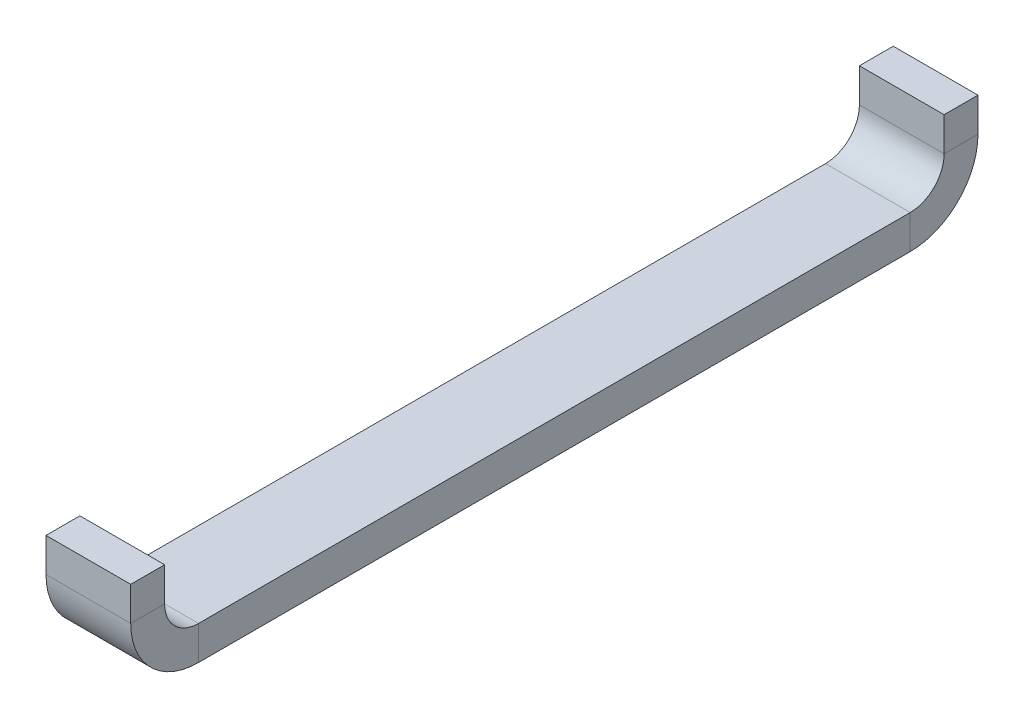
from build123d import *

# Parameters (mm, degrees)
ESQUISSE2_W                             = 5
ESQUISSE2_H                             = 50
T_LE_DE_BASE_PLI_E1_DEPTH               = 2
T_LE_PLI_E_SUR_AR_TE1_STRIP_W           = 12
T_LE_PLI_E_SUR_AR_TE1_STRIP_H           = 2
T_LE_PLI_E_SUR_AR_TE1_STRIP_CUT_DEPTH   = 5
T_LE_PLI_E_SUR_AR_TE1_STRIP_2_W         = 12
T_LE_PLI_E_SUR_AR_TE1_STRIP_2_H         = 2
T_LE_PLI_E_SUR_AR_TE1_STRIP_CUT_2_DEPTH = 5
T_LE_PLI_E_SUR_AR_TE1_DEPTH             = 5
T_LE_PLI_E_SUR_AR_TE1_BEND_DEPTH        = 5


# Sheet-metal steps are written as plain solids
with BuildPart() as part:
    # Esquisse2 → Tôle de base pliée1 (new body)
    with BuildSketch(Plane(origin=(0, 0, 0), x_dir=(1, 0, 0), z_dir=(0, 1, 0))):
        with Locations((2.5, 25)):
            Rectangle(ESQUISSE2_W, ESQUISSE2_H)
    extrude(amount=-T_LE_DE_BASE_PLI_E1_DEPTH)

    # Tôle pliée sur arête1 strip (across the edge) → Tôle pliée sur arête1 strip cut (cut)
    with BuildSketch(Plane(origin=(0, 0, 0), x_dir=(0, 0, -1), z_dir=(1, 0, 0))):
        with Locations((-2, -1)):
            Rectangle(T_LE_PLI_E_SUR_AR_TE1_STRIP_W, T_LE_PLI_E_SUR_AR_TE1_STRIP_H)
    extrude(amount=T_LE_PLI_E_SUR_AR_TE1_STRIP_CUT_DEPTH, mode=Mode.SUBTRACT)

    # Tôle pliée sur arête1 strip 2 (across the edge) → Tôle pliée sur arête1 strip cut 2 (cut)
    with BuildSketch(Plane(origin=(5, 0, -50), x_dir=(0, 0, 1), z_dir=(-1, 0, 0))):
        with Locations((-2, -1)):
            Rectangle(T_LE_PLI_E_SUR_AR_TE1_STRIP_2_W, T_LE_PLI_E_SUR_AR_TE1_STRIP_2_H)
    extrude(amount=T_LE_PLI_E_SUR_AR_TE1_STRIP_CUT_2_DEPTH, mode=Mode.SUBTRACT)

    # Tôle pliée sur arête1 section (across the edge) → Tôle pliée sur arête1 (add)
    with BuildSketch(Plane(origin=(0, 0, 0), x_dir=(0, 0, -1), z_dir=(1, 0, 0))):
        with BuildLine():
            Line((0, 2), (0, 4))
            Line((0, 4), (2, 4))
            Line((2, 4), (2, 2))
            ThreePointArc((2, 2), (2.585786438, 0.585786438), (4, 0))
            Line((4, 0), (4, -2))
            ThreePointArc((4, -2), (1.171572875, -0.828427125), (0, 2))
        make_face()
    extrude(amount=T_LE_PLI_E_SUR_AR_TE1_DEPTH)

    # Tôle pliée sur arête1 section 2 (across the edge) → Tôle pliée sur arête1 bend (add)
    with BuildSketch(Plane(origin=(5, 0, -50), x_dir=(0, 0, 1), z_dir=(-1, 0, 0))):
        with BuildLine():
            Line((0, 2), (0, 4))
            Line((0, 4), (2, 4))
            Line((2, 4), (2, 2))
            ThreePointArc((2, 2), (2.585786438, 0.585786438), (4, 0))
            Line((4, 0), (4, -2))
            ThreePointArc((4, -2), (1.171572875, -0.828427125), (0, 2))
        make_face()
    extrude(amount=T_LE_PLI_E_SUR_AR_TE1_BEND_DEPTH)


solid = part.part
